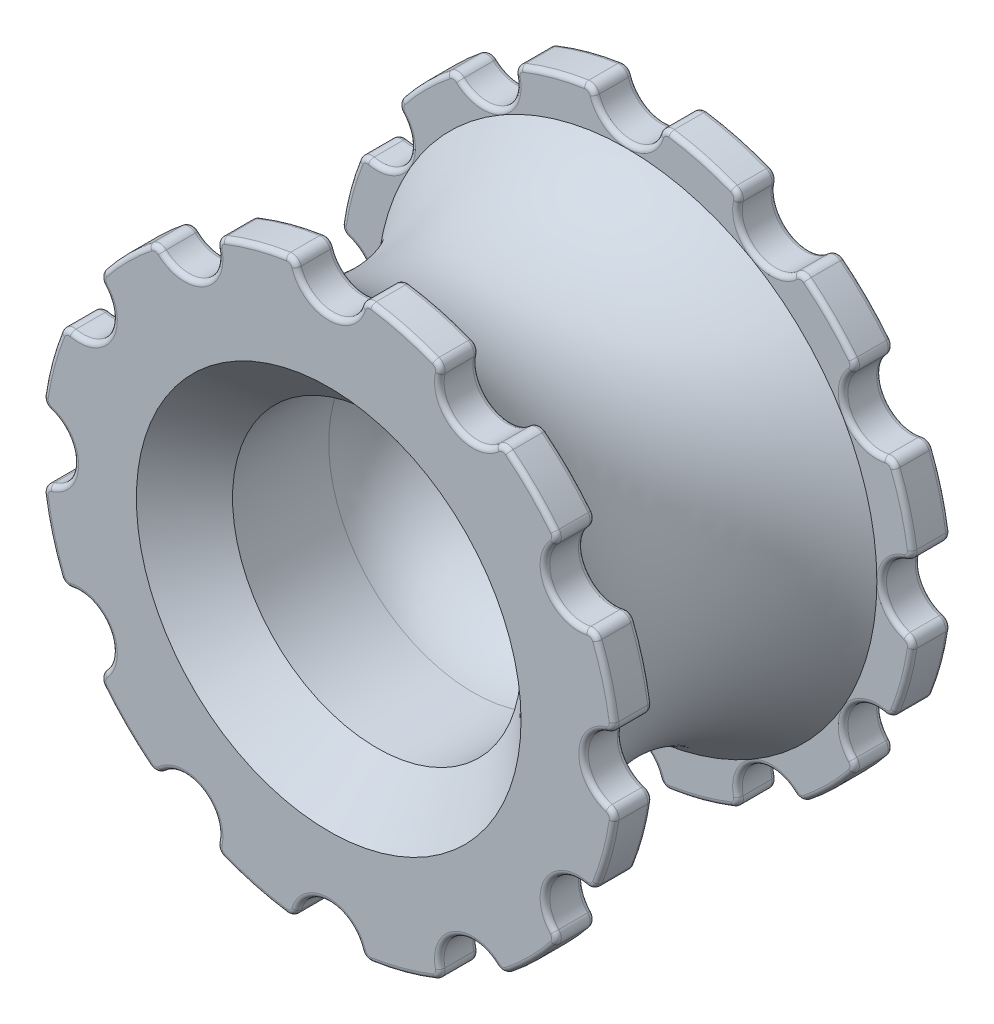
from build123d import *

# Parameters (mm, degrees)
EXTRUDE_1_DEPTH     = 35
FILLET_1_R          = 1
SKETCH_3_R          = 15
CUT_EXTRUDE_1_DEPTH = 25
FILLET_2_R          = 0.5
FILLET_3_R          = 10
CHAMFER_1_SIZE      = 5
SKETCH_4_R          = 6
EXTRUDE_2_DEPTH     = 1
SKETCH_5_R          = 3.75
EXTRUDE_3_DEPTH     = 3.5
SKETCH_6_R          = 2.7
CUT_EXTRUDE_2_DEPTH = 1
CUT_EXTRUDE_3_DEPTH = 8
SKETCH_8_R          = 1.475
CUT_EXTRUDE_4_DEPTH = 17


with BuildPart() as part:
    # Эскиз1 → Бобышка-Вытянуть1 (new body)
    with BuildSketch(Plane.XY):
        with BuildLine():
            ThreePointArc((-3.494040064, 29.795833333), (0, 26.5), (3.494040064, 29.795833333))
            ThreePointArc((3.494040064, 29.795833333), (7.764571353, 28.977774789), (11.871989209, 27.550968626))
            ThreePointArc((11.871989209, 27.550968626), (13.25, 22.9496732), (17.923844124, 24.056928561))
            ThreePointArc((17.923844124, 24.056928561), (21.213203436, 21.213203436), (24.056928561, 17.923844124))
            ThreePointArc((24.056928561, 17.923844124), (22.9496732, 13.25), (27.550968626, 11.871989209))
            ThreePointArc((27.550968626, 11.871989209), (28.977774789, 7.764571353), (29.795833333, 3.494040064))
            ThreePointArc((29.795833333, 3.494040064), (26.5, 0), (29.795833333, -3.494040064))
            ThreePointArc((29.795833333, -3.494040064), (28.977774789, -7.764571353), (27.550968626, -11.871989209))
            ThreePointArc((27.550968626, -11.871989209), (22.9496732, -13.25), (24.056928561, -17.923844124))
            ThreePointArc((24.056928561, -17.923844124), (21.213203436, -21.213203436), (17.923844124, -24.056928561))
            ThreePointArc((17.923844124, -24.056928561), (13.25, -22.9496732), (11.871989209, -27.550968626))
            ThreePointArc((11.871989209, -27.550968626), (7.764571353, -28.977774789), (3.494040064, -29.795833333))
            ThreePointArc((3.494040064, -29.795833333), (0, -26.5), (-3.494040064, -29.795833333))
            ThreePointArc((-3.494040064, -29.795833333), (-7.764571353, -28.977774789), (-11.871989209, -27.550968626))
            ThreePointArc((-11.871989209, -27.550968626), (-13.25, -22.9496732), (-17.923844124, -24.056928561))
            ThreePointArc((-17.923844124, -24.056928561), (-21.213203436, -21.213203436), (-24.056928561, -17.923844124))
            ThreePointArc((-24.056928561, -17.923844124), (-22.9496732, -13.25), (-27.550968626, -11.871989209))
            ThreePointArc((-27.550968626, -11.871989209), (-28.977774789, -7.764571353), (-29.795833333, -3.494040064))
            ThreePointArc((-29.795833333, -3.494040064), (-26.5, 0), (-29.795833333, 3.494040064))
            ThreePointArc((-29.795833333, 3.494040064), (-28.977774789, 7.764571353), (-27.550968626, 11.871989209))
            ThreePointArc((-27.550968626, 11.871989209), (-22.9496732, 13.25), (-24.056928561, 17.923844124))
            ThreePointArc((-24.056928561, 17.923844124), (-21.213203436, 21.213203436), (-17.923844124, 24.056928561))
            ThreePointArc((-17.923844124, 24.056928561), (-13.25, 22.9496732), (-11.871989209, 27.550968626))
            ThreePointArc((-11.871989209, 27.550968626), (-7.764571353, 28.977774789), (-3.494040064, 29.795833333))
        make_face()
    extrude(amount=EXTRUDE_1_DEPTH)

    # Скругление1
    fillet_1_edges = [part.edges().sort_by_distance(p)[0] for p in [
        (17.923844124, 24.056928561, 17.5),
        (24.056928561, 17.923844124, 17.5),
        (27.550968626, 11.871989209, 17.5),
        (29.795833333, 3.494040064, 17.5),
        (29.795833333, -3.494040064, 17.5),
        (27.550968626, -11.871989209, 17.5),
        (24.056928561, -17.923844124, 17.5),
        (17.923844124, -24.056928561, 17.5),
        (11.871989209, -27.550968626, 17.5),
        (3.494040064, -29.795833333, 17.5),
        (-3.494040064, -29.795833333, 17.5),
        (-11.871989209, -27.550968626, 17.5),
        (-17.923844124, -24.056928561, 17.5),
        (-24.056928561, -17.923844124, 17.5),
        (-27.550968626, -11.871989209, 17.5),
        (-29.795833333, -3.494040064, 17.5),
        (-29.795833333, 3.494040064, 17.5),
        (-27.550968626, 11.871989209, 17.5),
        (-24.056928561, 17.923844124, 17.5),
        (-17.923844124, 24.056928561, 17.5),
        (-11.871989209, 27.550968626, 17.5),
        (-3.494040064, 29.795833333, 17.5),
        (3.494040064, 29.795833333, 17.5),
        (11.871989209, 27.550968626, 17.5),
    ]]
    fillet(fillet_1_edges, radius=FILLET_1_R)

    # Эскиз2 → Вырез-Повернуть1 (revolve, cut)
    with BuildSketch(Plane(origin=(0, 0, 0), x_dir=(1, 0, 0), z_dir=(0, 1, 0)), mode=Mode.PRIVATE) as cut_revolve_1_sk:
        with BuildLine():
            Line((-30, -4), (-30, -31))
            Line((-30, -31), (-26, -31))
            ThreePointArc((-26, -31), (-20.756354563, -17.5), (-26, -4))
            Line((-26, -4), (-30, -4))
        make_face()
    revolve(cut_revolve_1_sk.sketch.rotate(Axis((0, 0, 1000), (0, 0, -1)), 180), axis=Axis((0, 0, 1000), (0, 0, -1)), mode=Mode.SUBTRACT)

    # Эскиз3 → Вырез-Вытянуть1 (cut)
    with BuildSketch(Plane.XY.offset(35)):
        Circle(SKETCH_3_R)
    extrude(amount=-CUT_EXTRUDE_1_DEPTH, mode=Mode.SUBTRACT)

    # Скругление2
    fillet_2_edges = [part.edges().sort_by_distance(p)[0] for p in [
        (-29.525356682, -3.768908965, 4),
        (-29.525356682, 3.768908965, 4),
        (-23.68525446, 18.02664925, 4),
        (-18.02664925, 23.68525446, 4),
        (-13.25, 22.9496732, 4),
        (-3.768908965, 29.525356682, 4),
        (3.768908965, 29.525356682, 4),
        (7.764571353, 28.977774789, 4),
        (11.498707433, 27.454163425, 4),
        (13.25, 22.9496732, 4),
        (23.68525446, 18.02664925, 4),
        (27.454163425, 11.498707433, 4),
        (29.525356682, 3.768908965, 4),
        (26.5, 0, 4),
        (28.977774789, -7.764571353, 4),
        (21.213203436, -21.213203436, 4),
        (18.02664925, -23.68525446, 4),
        (11.498707433, -27.454163425, 4),
        (7.764571353, -28.977774789, 4),
        (3.768908965, -29.525356682, 4),
        (0, -26.5, 4),
        (-11.498707433, -27.454163425, 4),
        (-13.25, -22.9496732, 4),
        (-18.02664925, -23.68525446, 4),
        (-21.213203436, -21.213203436, 4),
        (-27.454163425, -11.498707433, 4),
        (-29.525356682, -3.768908965, 31),
        (-26.5, 0, 31),
        (-29.525356682, 3.768908965, 31),
        (-28.977774789, 7.764571353, 31),
        (-27.454163425, 11.498707433, 31),
        (-21.213203436, 21.213203436, 31),
        (-18.02664925, 23.68525446, 31),
        (-11.498707433, 27.454163425, 31),
        (-7.764571353, 28.977774789, 31),
        (11.498707433, 27.454163425, 31),
        (21.213203436, 21.213203436, 31),
        (23.68525446, 18.02664925, 31),
        (22.9496732, 13.25, 31),
        (29.525356682, 3.768908965, 31),
        (26.5, 0, 31),
        (27.454163425, -11.498707433, 31),
        (22.9496732, -13.25, 31),
        (23.68525446, -18.02664925, 31),
        (18.02664925, -23.68525446, 31),
        (13.25, -22.9496732, 31),
        (11.498707433, -27.454163425, 31),
        (-3.768908965, -29.525356682, 31),
        (-7.764571353, -28.977774789, 31),
        (-11.498707433, -27.454163425, 31),
        (-13.25, -22.9496732, 31),
        (-27.454163425, -11.498707433, 31),
        (-29.525356682, 3.768908965, 35),
        (-28.977774789, 7.764571353, 35),
        (-22.9496732, 13.25, 35),
        (-21.213203436, 21.213203436, 35),
        (-18.02664925, 23.68525446, 35),
        (-11.498707433, 27.454163425, 35),
        (-7.764571353, 28.977774789, 35),
        (0, 26.5, 35),
        (3.768908965, 29.525356682, 35),
        (11.498707433, 27.454163425, 35),
        (28.977774789, 7.764571353, 35),
        (29.525356682, -3.768908965, 35),
        (28.977774789, -7.764571353, 35),
        (27.454163425, -11.498707433, 35),
        (23.68525446, -18.02664925, 35),
        (21.213203436, -21.213203436, 35),
        (18.02664925, -23.68525446, 35),
        (13.25, -22.9496732, 35),
        (3.768908965, -29.525356682, 35),
        (0, -26.5, 35),
        (-7.764571353, -28.977774789, 35),
        (-11.498707433, -27.454163425, 35),
        (-13.25, -22.9496732, 35),
        (-22.9496732, -13.25, 35),
        (-27.454163425, -11.498707433, 35),
        (-28.977774789, -7.764571353, 35),
        (-29.525356682, -3.768908965, 35),
        (3.768908965, 29.525356682, 0),
        (0, 26.5, 0),
        (-3.768908965, 29.525356682, 0),
        (-11.498707433, 27.454163425, 0),
        (-18.02664925, 23.68525446, 0),
        (-23.68525446, 18.02664925, 0),
        (-22.9496732, 13.25, 0),
        (-29.525356682, 3.768908965, 0),
        (-28.977774789, -7.764571353, 0),
        (-27.454163425, -11.498707433, 0),
        (-18.02664925, -23.68525446, 0),
        (-13.25, -22.9496732, 0),
        (-11.498707433, -27.454163425, 0),
        (-7.764571353, -28.977774789, 0),
        (-3.768908965, -29.525356682, 0),
        (0, -26.5, 0),
        (3.768908965, -29.525356682, 0),
        (22.9496732, -13.25, 0),
        (26.5, 0, 0),
        (29.525356682, 3.768908965, 0),
        (28.977774789, 7.764571353, 0),
        (27.454163425, 11.498707433, 0),
        (21.213203436, 21.213203436, 0),
        (-28.977774789, -7.764571353, 4),
        (-26.5, 0, 35),
    ]]
    fillet(fillet_2_edges, radius=FILLET_2_R - 0.0001)  # a hair under: the kernel refuses the full size

    # Скругление3
    fillet_3_edges = [part.edges().sort_by_distance(p)[0] for p in [
        (-15, 0, 10),
    ]]
    fillet(fillet_3_edges, radius=FILLET_3_R)

    # Фаска1
    chamfer_1_edges = [part.edges().sort_by_distance(p)[0] for p in [
        (-15, 0, 35),
    ]]
    chamfer(chamfer_1_edges, length=CHAMFER_1_SIZE)

    # Эскиз4 → Бобышка-Вытянуть2 (add)
    with BuildSketch(Plane(origin=(0, 0, 0), x_dir=(-1, 0, 0), z_dir=(0, 0, -1))):
        with Locations(Location((0, 0, 0), (0, 0, 180))):
            Circle(SKETCH_4_R)
    extrude(amount=EXTRUDE_2_DEPTH)

    # Эскиз5 → Бобышка-Вытянуть3 (add)
    with BuildSketch(Plane(origin=(0, 0, -1), x_dir=(-1, 0, 0), z_dir=(0, 0, -1))):
        Circle(SKETCH_5_R)
    extrude(amount=EXTRUDE_3_DEPTH)

    # Эскиз6 → Вырез-Вытянуть2 (cut)
    with BuildSketch(Plane(origin=(0, 0, -4.5), x_dir=(-1, 0, 0), z_dir=(0, 0, -1))):
        Circle(SKETCH_6_R)
    extrude(amount=-CUT_EXTRUDE_2_DEPTH, mode=Mode.SUBTRACT)

    # Эскиз7 → Вырез-Вытянуть3 (cut)
    with BuildSketch(Plane(origin=(0, 0, -3.5), x_dir=(-1, 0, 0), z_dir=(0, 0, -1))):
        with BuildLine():
            Line((-1.85, 1.966596044), (-1.85, -1.966596044))
            ThreePointArc((-1.85, -1.966596044), (0, -2.7), (1.85, -1.966596044))
            Line((1.85, -1.966596044), (1.85, 1.966596044))
            ThreePointArc((1.85, 1.966596044), (0, 2.7), (-1.85, 1.966596044))
        make_face()
    extrude(amount=-CUT_EXTRUDE_3_DEPTH, mode=Mode.SUBTRACT)

    # Эскиз8 → Вырез-Вытянуть4 (cut)
    with BuildSketch(Plane.XY.offset(10)):
        Circle(SKETCH_8_R)
    extrude(amount=-CUT_EXTRUDE_4_DEPTH, mode=Mode.SUBTRACT)


solid = part.part
